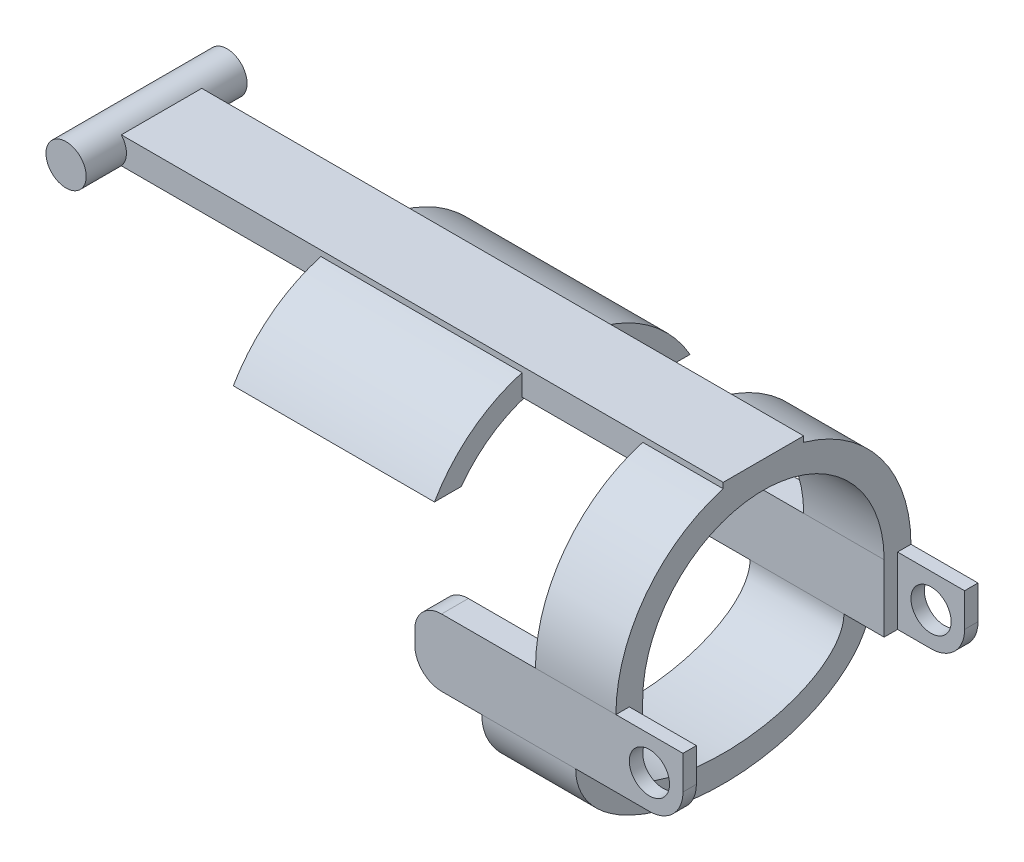
from build123d import *

# Parameters (mm, degrees)
SKETCH1_W                = 2
SKETCH1_H                = 5
BOSS_EXTRUDE1_DEPTH      = 15
BOSS_EXTRUDE1_2_DEPTH    = 15
SKETCH2_W                = 1
SKETCH2_H                = 5
BOSS_EXTRUDE2_DEPTH      = 5
CUT_EXTRUDE1_DEPTH       = 30.107559156
CUT_EXTRUDE1_DEPTH_BACK  = 30.107559156
SKETCH3_R                = 1.5
SWEEP1_START             = 9
SWEEP1_DEPTH             = 6
BOSS_EXTRUDE3_DEPTH      = 12
CUT_EXTRUDE2_DEPTH       = 5
FILLET1_R                = 2
BOSS_EXTRUDE6_START      = -6
SKETCH7_W                = 6
SKETCH7_H                = 2
BOSS_EXTRUDE6_DEPTH      = 46
BOSS_EXTRUDE7_DEPTH      = 3
BOSS_EXTRUDE7_DEPTH_BACK = 9
SKETCH8_R                = 1.5
FILLET2_R                = 2.5
BOSS_EXTRUDE10_DEPTH     = 15


# Read off the part's stored shape, not the designer's step: Sweep1
with BuildPart() as part:
    # Sketch1 → Boss-Extrude1 (new body)
    with BuildSketch(Plane(origin=(0, 0, 0), x_dir=(0, 0, -1), z_dir=(1, 0, 0))):
        with Locations((-10, 0)):
            Rectangle(SKETCH1_W, SKETCH1_H)
    extrude(amount=BOSS_EXTRUDE1_DEPTH)



with BuildPart() as body_2:
    # Sketch1 → Boss-Extrude1 2 (new body)
    with BuildSketch(Plane(origin=(0, 0, 0), x_dir=(0, 0, -1), z_dir=(1, 0, 0))):
        with Locations((10, 0)):
            Rectangle(SKETCH1_W, SKETCH1_H)
    extrude(amount=BOSS_EXTRUDE1_2_DEPTH)


with BuildPart() as part_1:
    add(part.part)

    add(body_2.part)  # Boss-Extrude2 merges body 2
    # Sketch2 → Boss-Extrude2 (add)
    with BuildSketch(Plane(origin=(15, 0, 0), x_dir=(0, 0, -1), z_dir=(1, 0, 0))):
        with Locations((10.5, 0)):
            Rectangle(SKETCH2_W, SKETCH2_H)
        with Locations((-10.5, 0)):
            Rectangle(SKETCH2_W, SKETCH2_H)
    extrude(amount=BOSS_EXTRUDE2_DEPTH)

    # Sketch3 → Cut-Extrude1 (cut, two sides: drawn at the far end of the back side and taken through both)
    with BuildSketch(Plane.XY.offset(-10).offset(-CUT_EXTRUDE1_DEPTH_BACK)):
        with Locations((17.5, 0)):
            Circle(SKETCH3_R)
    extrude(amount=CUT_EXTRUDE1_DEPTH + CUT_EXTRUDE1_DEPTH_BACK, mode=Mode.SUBTRACT)

    # Sweep1 outline → Sweep1 (add)
    with BuildSketch(Plane.YZ.offset(SWEEP1_START)):
        with BuildLine():
            ThreePointArc((2.5, -11), (13.5, 0), (2.5, 11))
            Line((2.5, 11), (2.5, 9))
            ThreePointArc((2.5, 9), (11.5, 0), (2.5, -9))
            Line((2.5, -9), (2.5, -11))
        make_face()
    extrude(amount=SWEEP1_DEPTH)

    # Sketch5 → Boss-Extrude3 (add)
    with BuildSketch(Plane(origin=(0, 0, 0), x_dir=(0, 0, -1), z_dir=(1, 0, 0))):
        with BuildLine():
            Line((-9, -2.5), (-11, -2.5))
            add(Edge.make_bspline(
                [(-11, -2.5), (-11, -8.980170496), (0, -8.980170496)],
                knots=[3.141592654, 3.141592654, 3.141592654, 4.71238898, 4.71238898, 4.71238898], degree=2, weights=[1, 0.707106781, 1]))
            Line((0, -8.980170496), (0, -7.009343108))
            add(Edge.make_bspline(
                [(-9, -2.5), (-9, -7.009343108), (0, -7.009343108)],
                knots=[3.141592654, 3.141592654, 3.141592654, 4.71238898, 4.71238898, 4.71238898], degree=2, weights=[1, 0.707106781, 1]))
        make_face()
    boss_extrude3 = extrude(amount=BOSS_EXTRUDE3_DEPTH)

    # Sketch6 → Cut-Extrude2 (cut)
    with BuildSketch(Plane.ZY):
        with BuildLine():
            Line((11, -2.5), (9, -2.5))
            add(Edge.make_bspline(
                [(0, -7.009343108), (9, -7.009343108), (9, -2.5)],
                knots=[4.71238898, 4.71238898, 4.71238898, 6.283185307, 6.283185307, 6.283185307], degree=2, weights=[1, 0.707106781, 1]))
            Line((0, -7.009343108), (0, -8.980170496))
            add(Edge.make_bspline(
                [(0, -8.980170496), (11, -8.980170496), (11, -2.5)],
                knots=[4.71238898, 4.71238898, 4.71238898, 6.283185307, 6.283185307, 6.283185307], degree=2, weights=[1, 0.707106781, 1]))
        make_face()
    cut_extrude2 = extrude(amount=-CUT_EXTRUDE2_DEPTH, mode=Mode.SUBTRACT)

    # Mirror2: Boss-Extrude3, Cut-Extrude2 across plane
    add(boss_extrude3.mirror(Plane(origin=(12, -8.980170496, 0), x_dir=(1, 0, 0), z_dir=(0, 0, 1))))
    add(cut_extrude2.mirror(Plane(origin=(12, -8.980170496, 0), x_dir=(1, 0, 0), z_dir=(0, 0, 1))), mode=Mode.SUBTRACT)

    # Fillet1
    fillet1_edges = [part_1.edges().sort_by_distance(p)[0] for p in [
        (0, -2.5, -10),
        (0, 2.5, -10),
        (0, 2.5, 10),
        (0, -2.5, 10),
    ]]
    fillet(fillet1_edges, radius=FILLET1_R)

    # Sketch7 → Boss-Extrude6 (add)
    with BuildSketch(Plane.ZY.offset(-9).offset(BOSS_EXTRUDE6_START)):
        with Locations((0, 12.5)):
            Rectangle(SKETCH7_W, SKETCH7_H)
    extrude(amount=BOSS_EXTRUDE6_DEPTH)

    # Sketch8 → Boss-Extrude7 (add, two sides: drawn at the far end of the back side and taken through both)
    with BuildSketch(Plane.XY.offset(3).offset(-BOSS_EXTRUDE7_DEPTH_BACK)):
        with Locations((-31, 12.5)):
            Circle(SKETCH8_R)
    extrude(amount=BOSS_EXTRUDE7_DEPTH + BOSS_EXTRUDE7_DEPTH_BACK)

    # Fillet2
    fillet2_edges = [part_1.edges().sort_by_distance(p)[0] for p in [
        (20, -2.5, -10.5),
        (20, -2.5, 10.5),
    ]]
    fillet(fillet2_edges, radius=FILLET2_R)

    # 3DSketch3 → Boss-Extrude10 (add)
    with BuildSketch(Plane(origin=(-15, 7.995255445, 9.529017137), x_dir=(0, 0, -1), z_dir=(1, 0, 0))):
        with BuildLine():
            Line((0, 0), (2, 0))
            ThreePointArc((2, 0), (9.529017137, 3.825899604), (17.058034273, 0))
            Line((17.058034273, 0), (19.058034273, 0))
            ThreePointArc((19.058034273, 0), (15.031388903, 4.029654263), (9.529017137, 5.504744555))
            ThreePointArc((9.529017137, 5.504744555), (4.026645371, 4.029654263), (0, 0))
        make_face()
    extrude(amount=BOSS_EXTRUDE10_DEPTH)


solid = part_1.part
